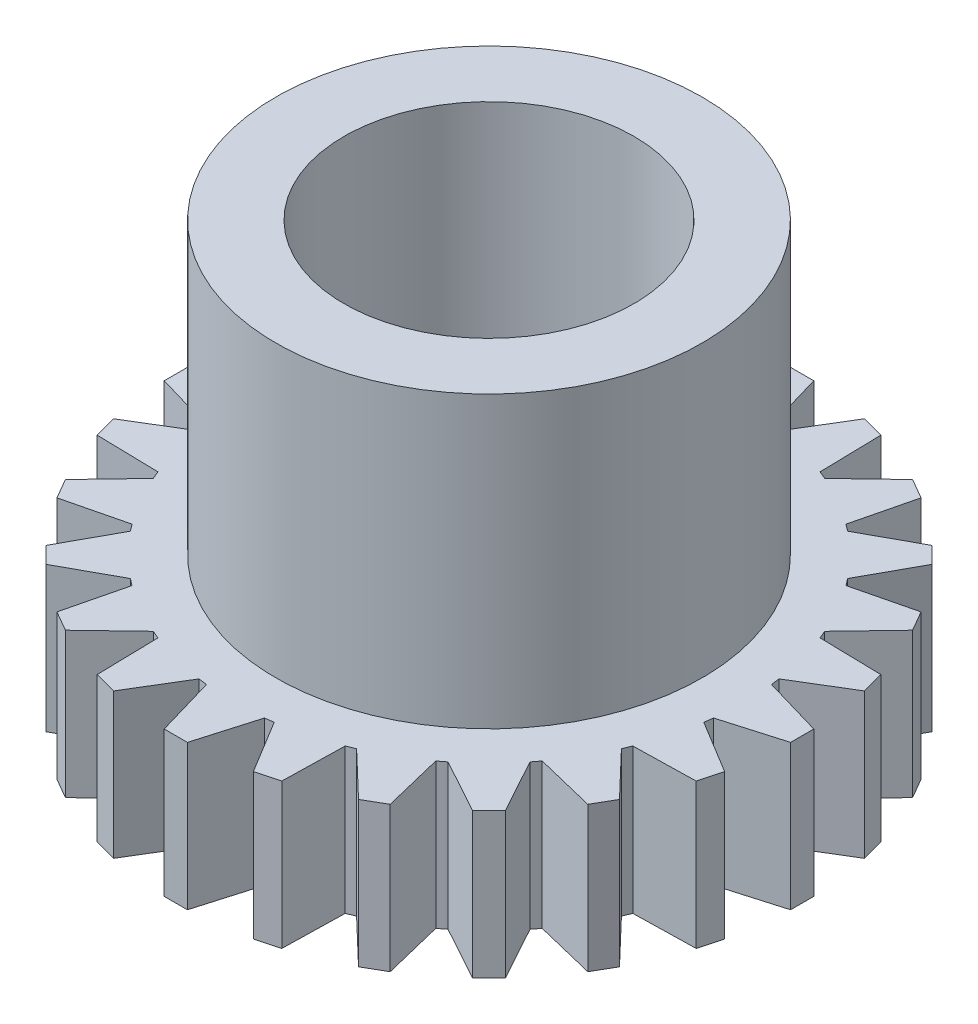
from build123d import *

# Parameters (mm, degrees)
SKETCH1_R           = 4.66725
SKETCH1_R_2         = 3.175
BOSS_EXTRUDE1_DEPTH = 9.525
BOSS_EXTRUDE2_DEPTH = 3.175
BOSS_EXTRUDE3_DEPTH = 3.175
CIRPATTERN1_COUNT   = 24


with BuildPart() as part:
    # Sketch1 → Boss-Extrude1 (new body)
    with BuildSketch(Plane(origin=(0, 0, 0), x_dir=(1, 0, 0), z_dir=(0, 1, 0))):
        Circle(SKETCH1_R)
        Circle(SKETCH1_R_2, mode=Mode.SUBTRACT)
    extrude(amount=BOSS_EXTRUDE1_DEPTH)

    # Sketch2 → Boss-Extrude2 (add)
    with BuildSketch(Plane(origin=(0, 0, 0), x_dir=(1, 0, 0), z_dir=(0, 1, 0))):
        with BuildLine():
            Line((0.635, 5.551803221), (-0.635, 5.551803221))
            ThreePointArc((-0.635, 5.551803221), (-3.720037903, -4.16977961), (5.588, 0))
            ThreePointArc((5.588, 0), (4.16977961, 3.720037903), (0.635, 5.551803221))
        make_face()
    extrude(amount=BOSS_EXTRUDE2_DEPTH)

    # Sketch2<3> → Boss-Extrude3 (add)
    with BuildSketch(Plane(origin=(0, 0, 0), x_dir=(1, 0, 0), z_dir=(0, 1, 0))):
        Polygon((-0.635, 5.551803221), (0.635, 5.551803221), (0.254, 6.858), (-0.254, 6.858), align=None)
    boss_extrude3 = extrude(amount=BOSS_EXTRUDE3_DEPTH)

    # CirPattern1: Boss-Extrude3 ×24 about axis
    cirpattern1_axis = Axis((0, 9.525, 0), (0, -1, 0))
    for i in range(1, CIRPATTERN1_COUNT):
        add(boss_extrude3.rotate(cirpattern1_axis, i * 360 / CIRPATTERN1_COUNT))


solid = part.part
